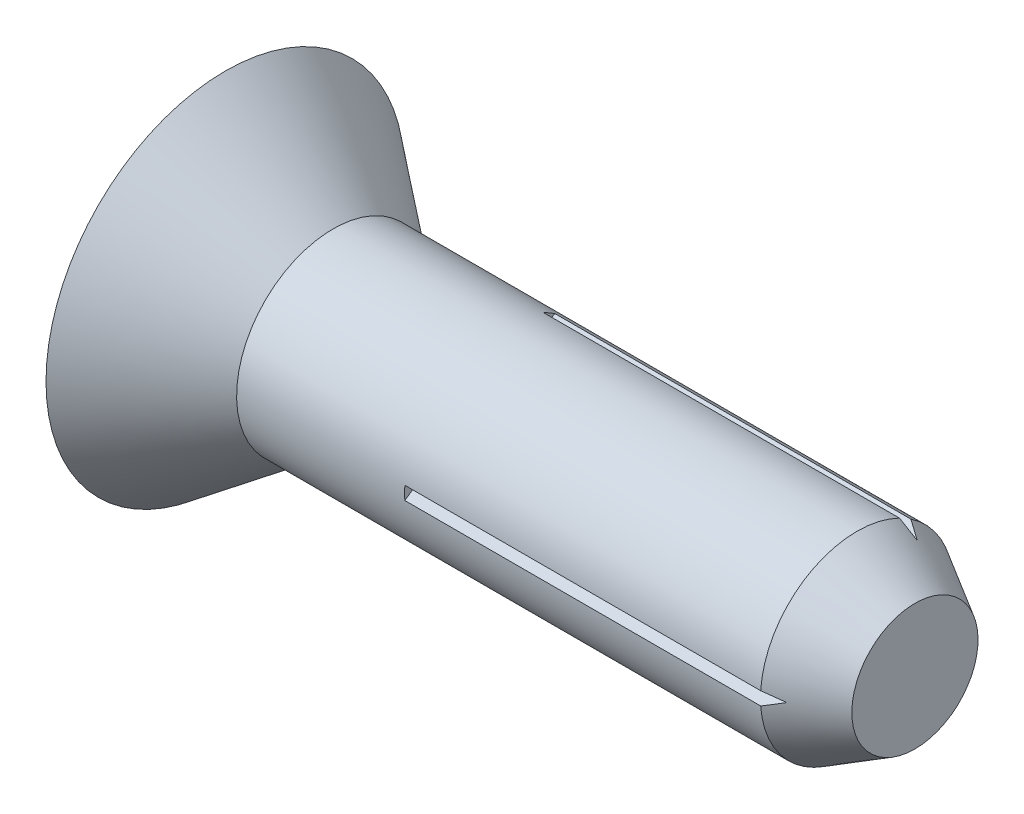
from build123d import *

# Parameters (mm, degrees)
CUT_EXTRUDE2_DEPTH = 3
CIRPATTERN2_COUNT  = 3


with BuildPart() as part:
    # Sketch1 → Base-Revolve (revolve)
    with BuildSketch(Plane(origin=(2.327621626, 1.627621626, 0), x_dir=(0, 1, 0), z_dir=(0, 0, 1))):
        Polygon((-1.627621626, -2.672378374), (-1.170108739, -2.672378374), (-0.927621626, -2.252378374), (-0.927621626, 2.327621626), (-1.627621626, 2.327621626), align=None)
    revolve(axis=Axis((-11.104148165, 0, 0), (1, 0, 0)))

    # Sketch6 → Cut-Extrude2 (cut)
    with BuildSketch(Plane(origin=(5, 0, 0), x_dir=(0, 0, -1), z_dir=(1, 0, 0))):
        Polygon((-0.7, 0.049014528), (-0.63, 0), (-0.7, -0.049014528), align=None)
    cut_extrude2 = extrude(amount=-CUT_EXTRUDE2_DEPTH, mode=Mode.SUBTRACT)

    # CirPattern2: Cut-Extrude2 ×3 about axis
    cirpattern2_axis = Axis((-11.104148165, 0, 0), (1, 0, 0))
    for i in range(1, CIRPATTERN2_COUNT):
        add(cut_extrude2.rotate(cirpattern2_axis, i * 360 / CIRPATTERN2_COUNT), mode=Mode.SUBTRACT)

    # Sketch7 → Revolve2 (revolve)
    with BuildSketch(Plane(origin=(3.60056552, 2.30056552, 0), x_dir=(0, 1, 0), z_dir=(0, 0, 1))):
        Polygon((-2.30056552, 3.60056552), (-1.00056552, 3.60056552), (-1.60056552, 2.818630297), (-2.30056552, 2.818630297), align=None)
    revolve(axis=Axis((-0.440243464, 0, 0), (1, 0, 0)))


solid = part.part
